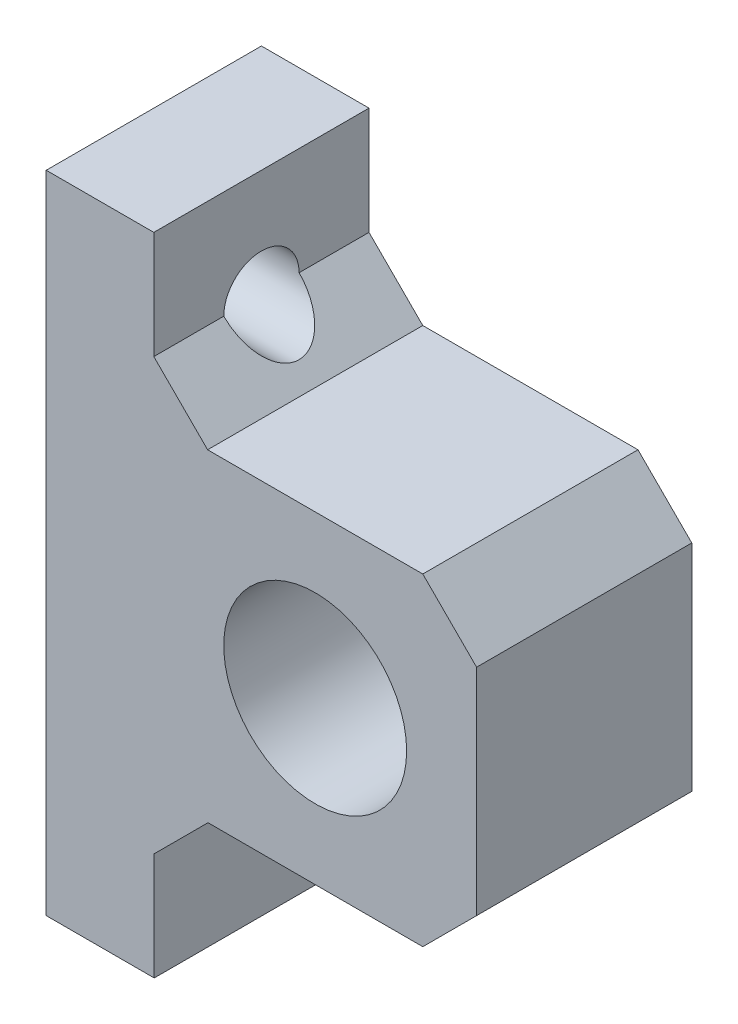
from build123d import *

# Parameters (mm, degrees)
SKETCH1_R           = 8.5
BOSS_EXTRUDE1_DEPTH = 20
CHAMFER1_SIZE       = 5
SKETCH2_R           = 3.5
CUT_EXTRUDE1_DEPTH  = 20
LPATTERN1_COUNT     = 200
LPATTERN1_PITCH     = 40


with BuildPart() as part:
    # Sketch1 → Boss-Extrude1 (new body)
    with BuildSketch(Plane.XY):
        Polygon((3.696498054, -34.435797665), (3.696498054, -19.435797665), (33.659197457, -19.435797665), (33.659197457, 10.564202335), (3.659197457, 10.564202335), (3.659197457, 25.564202335), (-6.340802543, 25.564202335), (-6.340802543, -34.435797665), align=None)
        with Locations((18.659197457, -4.435797665)):
            Circle(SKETCH1_R, mode=Mode.SUBTRACT)
    extrude(amount=BOSS_EXTRUDE1_DEPTH)

    # Chamfer1
    chamfer1_edges = [part.edges().sort_by_distance(p)[0] for p in [
        (3.696498054, -19.435797665, 10),
        (33.659197457, -19.435797665, 10),
        (33.659197457, 10.564202335, 10),
        (3.659197457, 10.564202335, 10),
    ]]
    chamfer(chamfer1_edges, length=CHAMFER1_SIZE)

    # Sketch2 → Cut-Extrude1 (cut)
    with BuildSketch(Plane.ZY.offset(6.340802543)):
        with Locations((10, 15.564202335)):
            Circle(SKETCH2_R)
    cut_extrude1 = extrude(amount=-CUT_EXTRUDE1_DEPTH, mode=Mode.SUBTRACT)

    # LPattern1: Cut-Extrude1 ×200
    with Locations(*[(0, -i * LPATTERN1_PITCH, 0) for i in range(1, LPATTERN1_COUNT)]):
        add(cut_extrude1, mode=Mode.SUBTRACT)


solid = part.part
